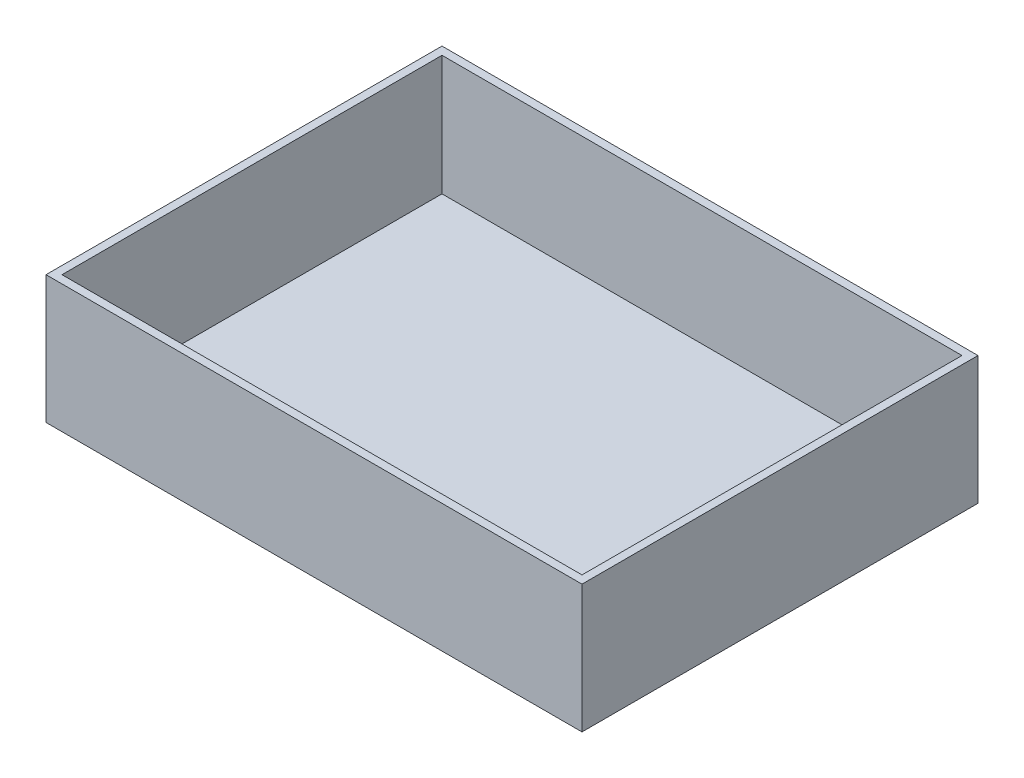
from build123d import *

# Parameters (mm, degrees)
CROQUIS1_W              = 268
CROQUIS1_H              = 198
CROQUIS1_W_2            = 260
CROQUIS1_H_2            = 190
SALIENTE_EXTRUIR1_DEPTH = 60
CROQUIS3_W              = 268
CROQUIS3_H              = 198
SALIENTE_EXTRUIR2_DEPTH = 4


with BuildPart() as part:
    # Croquis1 → Saliente-Extruir1 (new body)
    with BuildSketch(Plane(origin=(0, 0, 0), x_dir=(1, 0, 0), z_dir=(0, 1, 0))):
        Rectangle(CROQUIS1_W, CROQUIS1_H)
        Rectangle(CROQUIS1_W_2, CROQUIS1_H_2, mode=Mode.SUBTRACT)
    extrude(amount=SALIENTE_EXTRUIR1_DEPTH)

    # Croquis3 → Saliente-Extruir2 (add)
    with BuildSketch(Plane.XZ):
        Rectangle(CROQUIS3_W, CROQUIS3_H)
    extrude(amount=SALIENTE_EXTRUIR2_DEPTH)


solid = part.part
